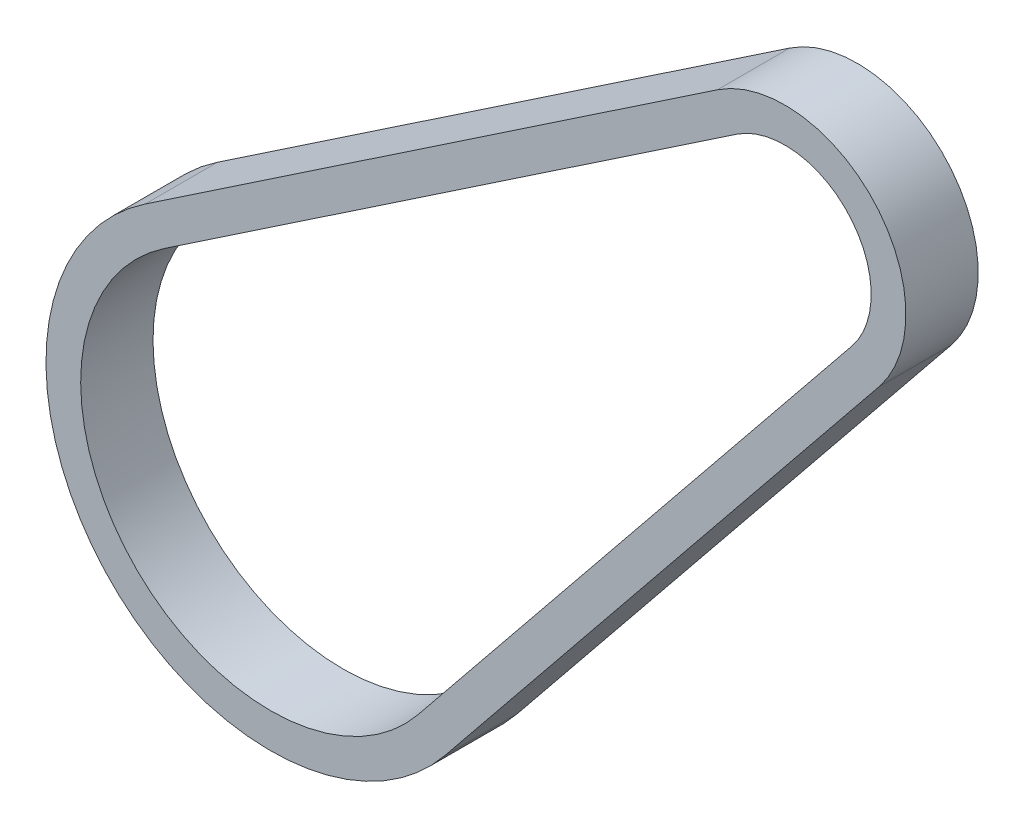
from build123d import *

# Parameters (mm, degrees)
EXTRUDE_THIN1_DEPTH = 5


with BuildPart() as part:
    # Sketch2 → Extrude-Thin1 (new body)
    with BuildSketch(Plane.XY):
        with BuildLine():
            Line((-44.228820851, -19.680698194), (-4.668038081, 6.937723225))
            ThreePointArc((-4.668038081, 6.937723225), (6.167391871, 5.646756643), (6.500196424, -5.260230938))
            Line((6.500196424, -5.260230938), (-23.495069562, -42.326117015))
            ThreePointArc((-23.495069562, -42.326117015), (-47.01236095, -43.043699353), (-44.228820851, -19.680698194))
        make_face()
        with BuildLine():
            Line((-42.889030332, -21.671919267), (-3.328247562, 4.946502151))
            ThreePointArc((-3.328247562, 4.946502151), (4.397266389, 4.026060564), (4.634551502, -3.750473002))
            Line((4.634551502, -3.750473002), (-25.360714484, -40.816359079))
            ThreePointArc((-25.360714484, -40.816359079), (-45.242235468, -41.423003274), (-42.889030332, -21.671919267))
        make_face(mode=Mode.SUBTRACT)
    extrude(amount=-EXTRUDE_THIN1_DEPTH)


solid = part.part
